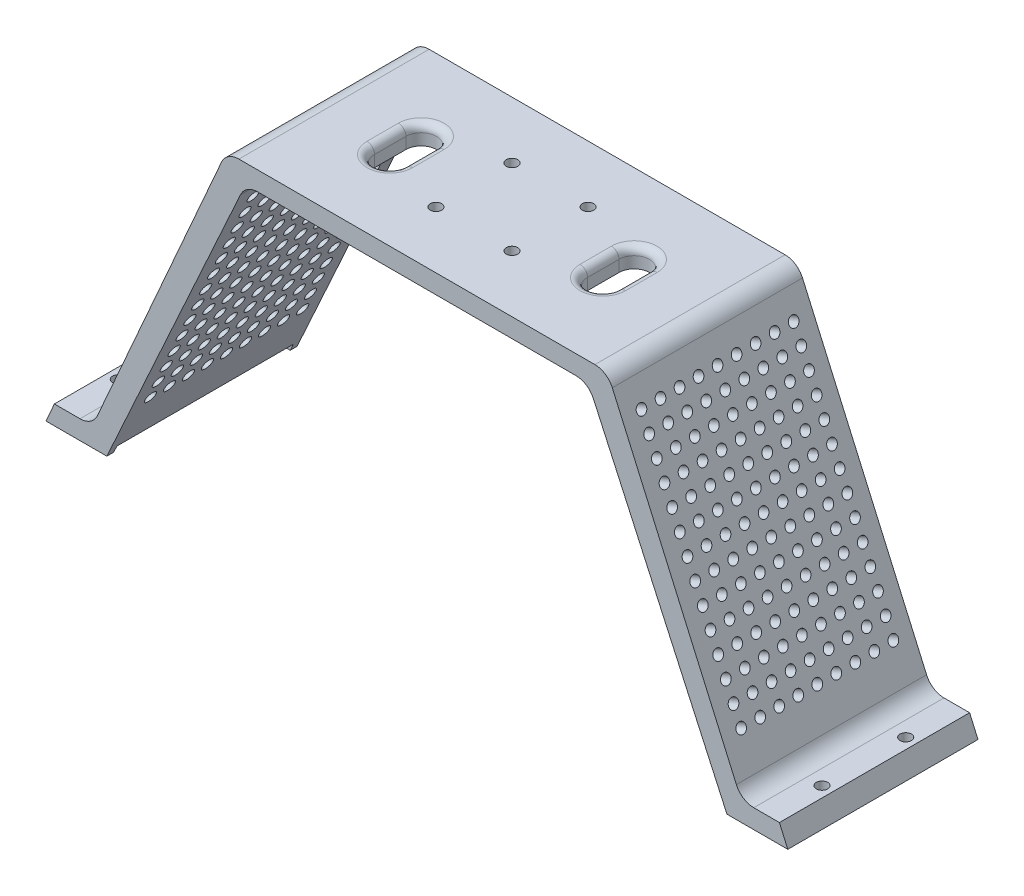
from build123d import *

# Parameters (mm, degrees)
BOSS_EXTRUDE2_DEPTH  = 50
CUT_EXTRUDE1_DEPTH   = 50
FILLET1_R            = 5
SKETCH10_W           = 50
SKETCH10_H           = 5.46
BOSS_EXTRUDE4_DEPTH  = 10
SKETCH5_W            = 50
SKETCH5_H            = 5.464
BOSS_EXTRUDE5_DEPTH  = 10
SKETCH11_R           = 1.5
CUT_EXTRUDE2_DEPTH   = 10
SKETCH12_R           = 1.5
CUT_EXTRUDE3_DEPTH   = 10
FILLET2_R            = 5
FILLET3_R            = 5
SKETCH13_R           = 1.5
CUT_EXTRUDE5_DEPTH   = 10
SKETCH14_R           = 3
CUT_EXTRUDE6_DEPTH   = 2.5
CUT_EXTRUDE8_DEPTH   = 8.5
FILLET5_R            = 2
SKETCH16_R           = 1.3
CUT_EXTRUDE9_DEPTH   = 12
LPATTERN1_COUNT      = 9
LPATTERN1_PITCH      = 5
LPATTERN1_COUNT_DIR2 = 14
LPATTERN1_PITCH_DIR2 = 5
SKETCH17_R           = 1.5
CUT_EXTRUDE10_DEPTH  = 12
LPATTERN2_COUNT      = 9
LPATTERN2_PITCH      = 5
LPATTERN2_COUNT_DIR2 = 14
LPATTERN2_PITCH_DIR2 = 5
SKETCH18_W           = 15.2
SKETCH18_H           = 46.4
CUT_EXTRUDE14_DEPTH  = 1.8
SKETCH19_W           = 15.2
SKETCH19_H           = 46.4
CUT_EXTRUDE15_DEPTH  = 1.8


with BuildPart() as part:
    # Sketch1 → Boss-Extrude2 (new body)
    with BuildSketch(Plane.XY):
        Polygon((-87.5, 0), (87.5, 0), (50.05, 85), (-50.05, 85), align=None)
    extrude(amount=BOSS_EXTRUDE2_DEPTH)

    # Sketch3 → Cut-Extrude1 (cut)
    with BuildSketch(Plane.XY.offset(50)):
        Polygon((-81.5, 0), (81.5, 0), (45.05, 80), (-45.05, 80), align=None)
    extrude(amount=-CUT_EXTRUDE1_DEPTH, mode=Mode.SUBTRACT)

    # Fillet1
    fillet1_edges = [part.edges().sort_by_distance(p)[0] for p in [
        (45.05, 80, 25),
        (-45.05, 80, 25),
    ]]
    fillet(fillet1_edges, radius=FILLET1_R)

    # Sketch10 → Boss-Extrude4 (add, along a direction that is not the sketch's normal)
    with BuildSketch(Plane(origin=(-73.275840836, 32.284473404, 0), x_dir=(0, 0, 1), z_dir=(-0.9151164849241618, 0.4031895571812924, 0))):
        with Locations((25, -32.549086253)):
            Rectangle(SKETCH10_W, SKETCH10_H)
    extrude(amount=BOSS_EXTRUDE4_DEPTH, dir=(-1, 0, 0))

    # Sketch5 → Boss-Extrude5 (add, along a direction that is not the sketch's normal)
    with BuildSketch(Plane(origin=(73.275840836, 32.284473404, 0), x_dir=(0, 0, -1), z_dir=(0.9151164849241616, 0.4031895571812925, 0))):
        with Locations((-25, -32.547086253)):
            Rectangle(SKETCH5_W, SKETCH5_H)
    extrude(amount=BOSS_EXTRUDE5_DEPTH, dir=(1, 0, 0))

    # Sketch11 → Cut-Extrude2 (cut)
    with BuildSketch(Plane(origin=(0, 4.996536008, 0), x_dir=(1, 0, 0), z_dir=(0, 1, 0))):
        with Locations((-92.5, -14)):
            Circle(SKETCH11_R)
        with Locations((-92.5, -36)):
            Circle(SKETCH11_R)
    extrude(amount=-CUT_EXTRUDE2_DEPTH, mode=Mode.SUBTRACT)

    # Sketch12 → Cut-Extrude3 (cut)
    with BuildSketch(Plane(origin=(0, 5.000196474, 0), x_dir=(1, 0, 0), z_dir=(0, 1, 0))):
        with Locations((92.5, -14)):
            Circle(SKETCH12_R)
        with Locations((92.5, -36)):
            Circle(SKETCH12_R)
    extrude(amount=-CUT_EXTRUDE3_DEPTH, mode=Mode.SUBTRACT)

    # Fillet2
    fillet2_edges = [part.edges().sort_by_distance(p)[0] for p in [
        (85.29697226, 5.000196474, 25),
        (-85.298585018, 4.996536008, 25),
    ]]
    fillet(fillet2_edges, radius=FILLET2_R)

    # Fillet3
    fillet3_edges = [part.edges().sort_by_distance(p)[0] for p in [
        (50.05, 85, 25),
        (-50.05, 85, 25),
    ]]
    fillet(fillet3_edges, radius=FILLET3_R)

    # Sketch13 → Cut-Extrude5 (cut)
    with BuildSketch(Plane(origin=(0, 85, 0), x_dir=(1, 0, 0), z_dir=(0, 1, 0))):
        with Locations((-9.999155874, -15)):
            Circle(SKETCH13_R)
        with Locations((10.000844126, -15)):
            Circle(SKETCH13_R)
        with Locations((-9.999155874, -35)):
            Circle(SKETCH13_R)
        with Locations((10.000844126, -35)):
            Circle(SKETCH13_R)
    extrude(amount=-CUT_EXTRUDE5_DEPTH, mode=Mode.SUBTRACT)

    # Sketch14 → Cut-Extrude6 (cut)
    with BuildSketch(Plane.XZ.offset(-80)):
        with Locations((-9.999155874, 35)):
            Circle(SKETCH14_R)
        with Locations((-9.999155874, 15)):
            Circle(SKETCH14_R)
        with Locations((10.000844126, 35)):
            Circle(SKETCH14_R)
        with Locations((10.000844126, 15)):
            Circle(SKETCH14_R)
    extrude(amount=-CUT_EXTRUDE6_DEPTH, mode=Mode.SUBTRACT)

    # Sketch15 → Cut-Extrude8 (cut)
    with BuildSketch(Plane(origin=(0, 85, 0), x_dir=(1, 0, 0), z_dir=(0, 1, 0))):
        with BuildLine():
            Line((-23.999155874, -20.87), (-23.999155874, -29.13))
            ThreePointArc((-23.999155874, -29.13), (-27.999155874, -33.13), (-31.999155874, -29.13))
            Line((-31.999155874, -29.13), (-31.999155874, -20.87))
            ThreePointArc((-31.999155874, -20.87), (-27.999155874, -16.87), (-23.999155874, -20.87))
        make_face()
        with BuildLine():
            Line((32.000844126, -20.87), (32.000844126, -29.13))
            ThreePointArc((32.000844126, -29.13), (28.000844126, -33.13), (24.000844126, -29.13))
            Line((24.000844126, -29.13), (24.000844126, -20.87))
            ThreePointArc((24.000844126, -20.87), (28.000844126, -16.87), (32.000844126, -20.87))
        make_face()
    extrude(amount=-CUT_EXTRUDE8_DEPTH, mode=Mode.SUBTRACT)

    # Fillet5
    fillet5_edges = [part.edges().sort_by_distance(p)[0] for p in [
        (-27.999155874, 85, 33.13),
        (-23.999155874, 85, 25),
        (-31.999155874, 85, 25),
        (-27.999155874, 85, 16.87),
        (28.000844126, 85, 16.87),
        (32.000844126, 85, 25),
        (24.000844126, 85, 25),
        (28.000844126, 85, 33.13),
    ]]
    fillet(fillet5_edges, radius=FILLET5_R)

    # Sketch16 → Cut-Extrude9 (cut)
    with BuildSketch(Plane(origin=(73.275840836, 32.284473404, 0), x_dir=(0, 0, -1), z_dir=(0.9151164849241616, 0.4031895571812925, 0))):
        with Locations((-45, 47.710567453)):
            Circle(SKETCH16_R)
    cut_extrude9 = extrude(amount=-CUT_EXTRUDE9_DEPTH, mode=Mode.SUBTRACT)

    # LPattern1: Cut-Extrude9 9 × 14
    with Locations(*[Vector(0, 0, -1) * (i * LPATTERN1_PITCH) + Vector(0.40318955718129246, -0.9151164849241616, 0) * (j * LPATTERN1_PITCH_DIR2) for i in range(LPATTERN1_COUNT) for j in range(LPATTERN1_COUNT_DIR2) if (i, j) != (0, 0)]):
        add(cut_extrude9, mode=Mode.SUBTRACT)

    # Sketch17 → Cut-Extrude10 (cut)
    with BuildSketch(Plane(origin=(-73.275840836, 32.284473404, 0), x_dir=(0, 0, 1), z_dir=(-0.9151164849241618, 0.4031895571812924, 0))):
        with Locations((5, 47.714419756)):
            Circle(SKETCH17_R)
    cut_extrude10 = extrude(amount=-CUT_EXTRUDE10_DEPTH, mode=Mode.SUBTRACT)

    # LPattern2: Cut-Extrude10 9 × 14
    with Locations(*[Vector(0, 0, 1) * (i * LPATTERN2_PITCH) + Vector(-0.40318955718129224, -0.9151164849241618, 0) * (j * LPATTERN2_PITCH_DIR2) for i in range(LPATTERN2_COUNT) for j in range(LPATTERN2_COUNT_DIR2) if (i, j) != (0, 0)]):
        add(cut_extrude10, mode=Mode.SUBTRACT)

    # Sketch18 → Cut-Extrude14 (cut)
    with BuildSketch(Plane.XZ):
        with Locations((88.1, 25)):
            Rectangle(SKETCH18_W, SKETCH18_H)
    extrude(amount=-CUT_EXTRUDE14_DEPTH, mode=Mode.SUBTRACT)

    # Sketch19 → Cut-Extrude15 (cut)
    with BuildSketch(Plane.XZ):
        with Locations((-88.1, 25)):
            Rectangle(SKETCH19_W, SKETCH19_H)
    extrude(amount=-CUT_EXTRUDE15_DEPTH, mode=Mode.SUBTRACT)


solid = part.part
